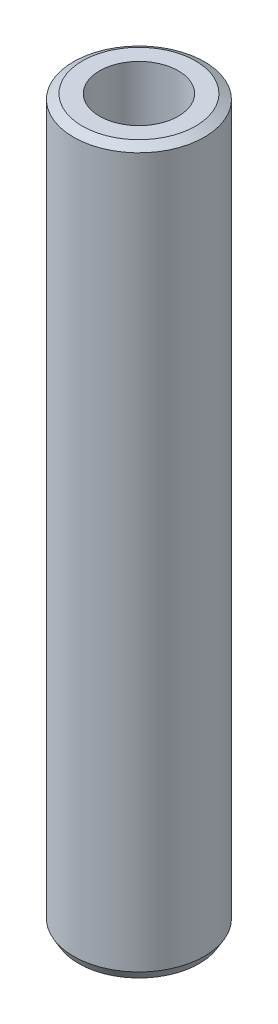
from build123d import *
from OCP.BRepFilletAPI import BRepFilletAPI_MakeChamfer

# Parameters (mm, degrees)
SKETCH1_R           = 30
BOSS_EXTRUDE1_DEPTH = 331.626546122
SKETCH2_R           = 18.052022872
CUT_EXTRUDE1_DEPTH  = 335.329427501
CHAMFER1_SIZE       = 2.344098431
CHAMFER1_SIZE2      = 4.060097581


with BuildPart() as part:
    # Sketch1 → Boss-Extrude1 (new body)
    with BuildSketch(Plane(origin=(0, 0, 0), x_dir=(1, 0, 0), z_dir=(0, 1, 0))):
        Circle(SKETCH1_R)
    extrude(amount=BOSS_EXTRUDE1_DEPTH)

    # Sketch2 → Cut-Extrude1 (cut, through all)
    with BuildSketch(Plane(origin=(0, 0, 0), x_dir=(1, 0, 0), z_dir=(0, 1, 0))):
        Circle(SKETCH2_R)
    extrude(amount=CUT_EXTRUDE1_DEPTH, mode=Mode.SUBTRACT)

    # Chamfer1: one chamfer whose edges measure the first distance from different faces: ONE call of the kernel's chamfer builder (chamfer() names one face for all edges)
    chamfer1_edges_1 = [part.edges().sort_by_distance(p)[0] for p in [
        (-30, 331.626546122, 0),
    ]]
    chamfer1_side_1 = [part.faces().sort_by_distance(p)[0] for p in [
        (-30, 165.813273061, 0),
    ]]
    chamfer1_edges_2 = [part.edges().sort_by_distance(p)[0] for p in [
        (-30, 0, 0),
    ]]
    chamfer1_side_2 = [part.faces().sort_by_distance(p)[0] for p in [
        (-29.151471863, 0, 0),
    ]]
    chamfer1 = BRepFilletAPI_MakeChamfer(part.part.solid().wrapped)
    for e in chamfer1_edges_1:
        chamfer1.Add(CHAMFER1_SIZE, CHAMFER1_SIZE2, e.wrapped, chamfer1_side_1[0].wrapped)  # the first distance lies on this face
    for e in chamfer1_edges_2:
        chamfer1.Add(CHAMFER1_SIZE, CHAMFER1_SIZE2, e.wrapped, chamfer1_side_2[0].wrapped)  # the first distance lies on this face
    add(Compound.cast(chamfer1.Shape()), mode=Mode.REPLACE)


solid = part.part
